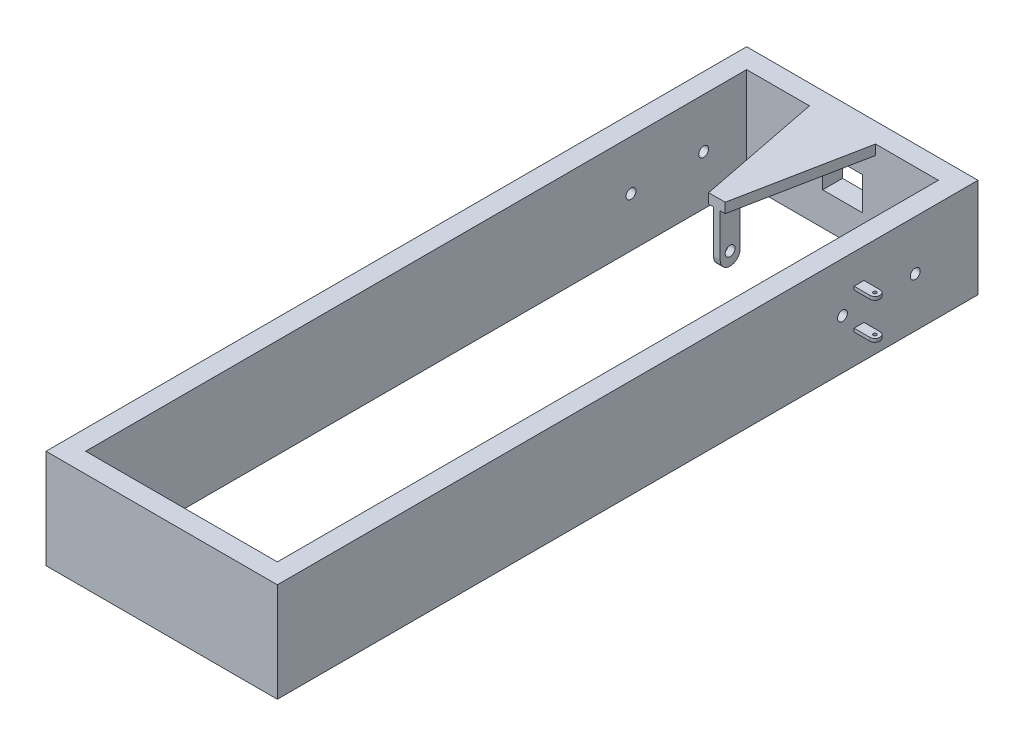
from build123d import *

# Parameters (mm, degrees)
SKETCH1_W            = 70
SKETCH1_H            = 212
SKETCH1_W_2          = 58
SKETCH1_H_2          = 200
BOSS_EXTRUDE1_DEPTH  = 30
SKETCH10_W           = 2
SKETCH10_H           = 6
BOSS_EXTRUDE3_DEPTH  = 16
FILLET2_R            = 3
SKETCH2_R            = 1.5
CUT_EXTRUDE1_DEPTH   = 131.52202895
CUT_EXTRUDE2_REACH   = 218.954
SKETCH3_W            = 12
SKETCH3_H            = 10
SKETCH11_W           = 3
SKETCH11_H           = 1
BOSS_EXTRUDE4_DEPTH  = 6.3
FILLET3_R            = 1.5
SKETCH12_R           = 0.5
CUT_EXTRUDE3_DEPTH   = 116.683577146
FILLET3_OF_MIRROR1_R = 1.5


with BuildPart() as part:
    # Sketch1 → Boss-Extrude1 (new body)
    with BuildSketch(Plane(origin=(0, 0, 0), x_dir=(1, 0, 0), z_dir=(0, 1, 0))):
        Rectangle(SKETCH1_W, SKETCH1_H)
        Rectangle(SKETCH1_W_2, SKETCH1_H_2, mode=Mode.SUBTRACT)
    extrude(amount=BOSS_EXTRUDE1_DEPTH)

    # Sketch7 → Loft3 section 0
    with BuildSketch(Plane.XY.offset(-100)):
        with BuildLine():
            Line((-10, 30), (10, 30))
            Line((10, 30), (10, 27))
            Line((10, 27), (-10, 27))
            Line((-10, 27), (-10, 30))
        make_face()
    # Sketch8 → Loft3 section 1
    with BuildSketch(Plane.XY.offset(-62)):
        with BuildLine():
            Line((-2.5, 30), (2.5, 30))
            Line((2.5, 30), (2.5, 27))
            Line((2.5, 27), (-2.5, 27))
            Line((-2.5, 27), (-2.5, 30))
        make_face()
    loft()

    # Sketch10 → Boss-Extrude3 (add)
    with BuildSketch(Plane.XZ.offset(-27)):
        with Locations((0, -65)):
            Rectangle(SKETCH10_W, SKETCH10_H)
    extrude(amount=BOSS_EXTRUDE3_DEPTH)

    # Fillet2
    fillet2_edges = [part.edges().sort_by_distance(p)[0] for p in [
        (0, 11, -68),
        (0, 11, -62),
    ]]
    fillet(fillet2_edges, radius=FILLET2_R - 0.0001)  # a hair under: the kernel refuses the full size

    # Sketch2 → Cut-Extrude1 (cut, through all)
    with BuildSketch(Plane(origin=(35, 0, 0), x_dir=(0, 0, -1), z_dir=(1, 0, 0))):
        with Locations(Location((65, 15, 0), (0, 0, 270))):
            Circle(SKETCH2_R)
        with Locations((87, 15)):
            Circle(SKETCH2_R)
    extrude(amount=-CUT_EXTRUDE1_DEPTH, mode=Mode.SUBTRACT)

    # Sketch3 → Cut-Extrude2 (cut, up to next)
    with BuildSketch(Plane(origin=(0, 0, -106), x_dir=(-1, 0, 0), z_dir=(0, 0, -1)), mode=Mode.PRIVATE) as cut_extrude2_sk1:
        with Locations((0, 15)):
            Rectangle(SKETCH3_W, SKETCH3_H)
    cut_extrude2_tool1 = extrude(cut_extrude2_sk1.sketch, amount=-CUT_EXTRUDE2_REACH, mode=Mode.PRIVATE) & part.part
    add(cut_extrude2_tool1.solids().sort_by_distance((0, 15, -106))[0], mode=Mode.SUBTRACT)

    # Sketch11 → Boss-Extrude4 (add)
    with BuildSketch(Plane(origin=(35, 0, 0), x_dir=(0, 0, -1), z_dir=(1, 0, 0))):
        with Locations((70, 20.5)):
            Rectangle(SKETCH11_W, SKETCH11_H)
        with Locations((70, 9.5)):
            Rectangle(SKETCH11_W, SKETCH11_H)
    boss_extrude4 = extrude(amount=BOSS_EXTRUDE4_DEPTH)

    # Fillet3
    fillet3_edges = [part.edges().sort_by_distance(p)[0] for p in [
        (41.3, 9.5, -68.5),
        (41.3, 9.5, -71.5),
        (41.3, 20.5, -68.5),
        (41.3, 20.5, -71.5),
    ]]
    fillet(fillet3_edges, radius=FILLET3_R - 0.0001)  # a hair under: the kernel refuses the full size

    # Sketch12 → Cut-Extrude3 (cut, through all)
    with BuildSketch(Plane(origin=(0, 21, 0), x_dir=(1, 0, 0), z_dir=(0, 1, 0))):
        with Locations(Location((39.8, 70, 0), (0, 0, 270))):
            Circle(SKETCH12_R)
    cut_extrude3 = extrude(amount=-CUT_EXTRUDE3_DEPTH, mode=Mode.SUBTRACT)

    # Mirror1: Boss-Extrude4, Cut-Extrude3 across plane
    add(boss_extrude4.mirror(Plane(origin=(0, 0, 0), x_dir=(0, 0, 1), z_dir=(1, 0, 0))))
    add(cut_extrude3.mirror(Plane(origin=(0, 0, 0), x_dir=(0, 0, 1), z_dir=(1, 0, 0))), mode=Mode.SUBTRACT)

    # Fillet3 of Mirror1
    fillet3_of_mirror1_edges = [part.edges().sort_by_distance(p)[0] for p in [
        (-41.3, 9.5, -68.5),
        (-41.3, 9.5, -71.5),
        (-41.3, 20.5, -68.5),
        (-41.3, 20.5, -71.5),
    ]]
    fillet(fillet3_of_mirror1_edges, radius=FILLET3_OF_MIRROR1_R - 0.0001)  # a hair under: the kernel refuses the full size


solid = part.part
